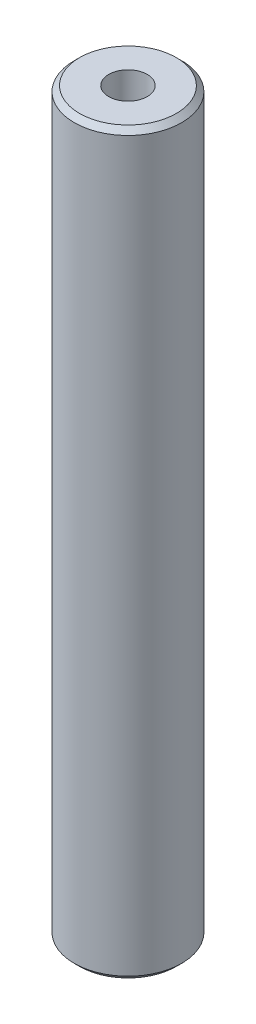
from build123d import *

# Parameters (mm, degrees)
SKETCH1_R           = 17.5
BOSS_EXTRUDE1_DEPTH = 240.657700329
SKETCH2_R           = 6.278145002
CUT_EXTRUDE1_DEPTH  = 242.92690782
CHAMFER1_SIZE       = 1.730177194


with BuildPart() as part:
    # Sketch1 → Boss-Extrude1 (new body)
    with BuildSketch(Plane(origin=(0, 0, 0), x_dir=(1, 0, 0), z_dir=(0, 1, 0))):
        Circle(SKETCH1_R)
    extrude(amount=BOSS_EXTRUDE1_DEPTH)

    # Sketch2 → Cut-Extrude1 (cut, through all)
    with BuildSketch(Plane(origin=(0, 0, 0), x_dir=(1, 0, 0), z_dir=(0, 1, 0))):
        Circle(SKETCH2_R)
    extrude(amount=CUT_EXTRUDE1_DEPTH, mode=Mode.SUBTRACT)

    # Chamfer1
    chamfer1_edges = [part.edges().sort_by_distance(p)[0] for p in [
        (-17.5, 240.657700329, 0),
        (-17.5, 0, 0),
    ]]
    chamfer(chamfer1_edges, length=CHAMFER1_SIZE)


solid = part.part
